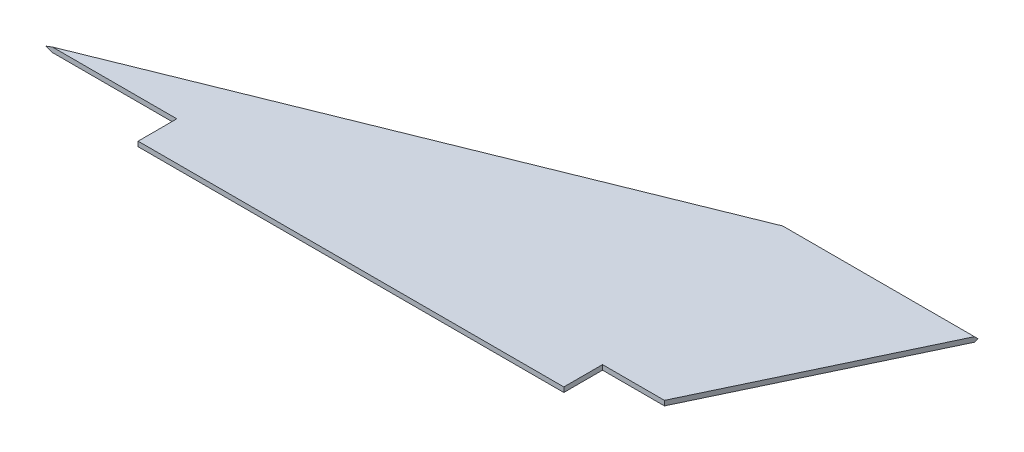
from build123d import *

# Parameters (mm, degrees)
BOSS_EXTRUDE1_DEPTH = 3.175
CHAMFER1_SIZE       = 1.778


with BuildPart() as part:
    # Sketch1 → Boss-Extrude1 (new body)
    with BuildSketch(Plane(origin=(0, 0, 0), x_dir=(1, 0, 0), z_dir=(0, 1, 0))):
        Polygon((279.4, 25.4), (320.04, 25.4), (386.409633422, 165.1), (259.409633422, 165.1), (-86.36, 25.4), (0, 25.4), (0, 0), (279.4, 0), align=None)
    extrude(amount=BOSS_EXTRUDE1_DEPTH)

    # Chamfer1
    # the kernel refuses this chamfer: 1.778 mm, written as the material it takes off along each edge
    with BuildSketch(Plane(origin=(263.649137419, 3.175, -166.812870799), x_dir=(-0.01030013667007983, -0.9996219169112964, -0.02549373286050588), z_dir=(-0.9271838545667884, 0, 0.3746065934159097))) as chamfer1_piece_1:
        Polygon((CHAMFER1_SIZE * 0.999621916911, CHAMFER1_SIZE * 0.0274958766106), (-CHAMFER1_SIZE * 0.0274958766106, CHAMFER1_SIZE * 0.999621916911), (0, 0), align=None)
    extrude(amount=382.069467314, mode=Mode.SUBTRACT)
    with BuildSketch(Plane(origin=(263.649137419, 0, -166.812870799), x_dir=(-0.01030013667007983, 0.9996219169112964, -0.02549373286050588), z_dir=(-0.9271838545667884, 0, 0.3746065934159097))) as chamfer1_piece_2:
        Polygon((CHAMFER1_SIZE * 0.999621916911, -CHAMFER1_SIZE * 0.0274958766106), (-CHAMFER1_SIZE * 0.0274958766106, -CHAMFER1_SIZE * 0.999621916911), (0, 0), align=None)
    extrude(amount=382.069467314, mode=Mode.SUBTRACT)

    # Chamfer2
    # the kernel refuses this chamfer: 1.778 mm, written as the material it takes off along each edge
    with BuildSketch(Plane(origin=(397.383519069, 3.175, -165.1), x_dir=(0, 0.027495876610586497, 0.9996219169112968), z_dir=(-1, 0, 0))) as chamfer2_piece_1:
        with BuildLine():
            Line((1.828980941, 0), (-0.100540841, -1.826215437))
            Line((-0.100540841, -1.826215437), (-0.136087397, -1.825237684))
            ThreePointArc((-0.136087397, -1.825237684), (-0.060681766, -0.912821341), (-0.035546555, 0.000977753))
            Line((-0.035546555, 0.000977753), (0.000977753, 0.035546555))
            ThreePointArc((0.000977753, 0.035546555), (0.914776848, 0.010411345), (1.829958694, 0.035546555))
            Line((1.829958694, 0.035546555), (1.828980941, 0))
        make_face()
    extrude(amount=144.201458677, mode=Mode.SUBTRACT)
    with BuildSketch(Plane(origin=(397.383519069, 0, -165.1), x_dir=(0, -0.02749587661058638, 0.9996219169112968), z_dir=(-1, 0, 0))) as chamfer2_piece_2:
        with BuildLine():
            Line((1.828980941, 0), (-0.100540841, 1.826215437))
            Line((-0.100540841, 1.826215437), (-0.136087397, 1.825237684))
            ThreePointArc((-0.136087397, 1.825237684), (-0.060681766, 0.912821341), (-0.035546555, -0.000977753))
            Line((-0.035546555, -0.000977753), (0.000977753, -0.035546555))
            ThreePointArc((0.000977753, -0.035546555), (0.914776848, -0.010411345), (1.829958694, -0.035546555))
            Line((1.829958694, -0.035546555), (1.828980941, 0))
        make_face()
    extrude(amount=144.201458677, mode=Mode.SUBTRACT)


solid = part.part
